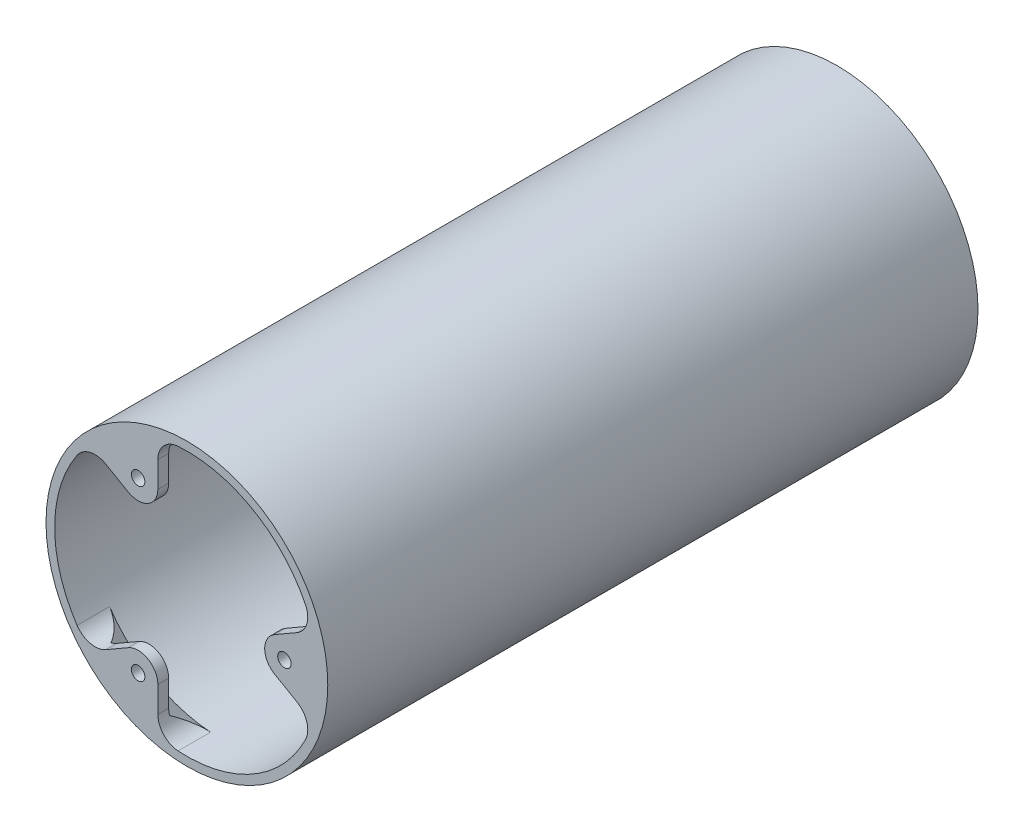
from build123d import *

# Parameters (mm, degrees)
SKETCH1_R           = 32.5
SKETCH1_R_2         = 30.5
BOSS_EXTRUDE1_DEPTH = 150
BOSS_EXTRUDE2_START = -2.5
SKETCH2_R           = 1.55
BOSS_EXTRUDE2_DEPTH = 2.5
FILLET1_R           = 5
CHAMFER1_START      = 142.49999956
CHAMFER1_DEPTH      = 5.00000044
CHAMFER1_START_2    = 142.499980406
CHAMFER1_3_DEPTH    = 5.000019594


with BuildPart() as part:
    # Sketch1 → Boss-Extrude1 (new body)
    with BuildSketch(Plane.XY):
        Circle(SKETCH1_R)
        Circle(SKETCH1_R_2, mode=Mode.SUBTRACT)
    extrude(amount=BOSS_EXTRUDE1_DEPTH)

    # Sketch2 → Boss-Extrude2 (add)
    # profile 1 of 3: a face of its own
    with BuildSketch(Plane.XY.offset(150).offset(BOSS_EXTRUDE2_START)):
        with BuildLine():
            Line((20.225, -3.940415587), (29.118585526, -9.075129585))
            ThreePointArc((29.118585526, -9.075129585), (30.152668692, -4.58983341), (30.5, 0))
            ThreePointArc((30.5, 0), (30.152668692, 4.58983341), (29.118585526, 9.075129585))
            Line((29.118585526, 9.075129585), (20.225, 3.940415587))
            ThreePointArc((20.225, 3.940415587), (17.95, 0), (20.225, -3.940415587))
        make_face()
        with Locations((22.5, 0)):
            Circle(SKETCH2_R, mode=Mode.SUBTRACT)
    # profile 2 of 3: a face of its own
    with BuildSketch(Plane.XY.offset(150).offset(BOSS_EXTRUDE2_START)):
        with BuildLine():
            ThreePointArc((-6.7, 29.75499958), (-15.25, 26.413774815), (-22.418585526, 20.679869995))
            Line((-22.418585526, 20.679869995), (-13.525, 15.545155998))
            ThreePointArc((-13.525, 15.545155998), (-8.975, 15.545155998), (-6.7, 19.485571585))
            Line((-6.7, 19.485571585), (-6.7, 29.75499958))
        make_face()
        with Locations((-11.25, 19.485571585)):
            Circle(SKETCH2_R, mode=Mode.SUBTRACT)
    # profile 3 of 3: a face of its own
    with BuildSketch(Plane.XY.offset(150).offset(BOSS_EXTRUDE2_START)):
        with BuildLine():
            ThreePointArc((-22.418585526, -20.679869995), (-15.25, -26.413774815), (-6.7, -29.75499958))
            Line((-6.7, -29.75499958), (-6.7, -19.485571585))
            ThreePointArc((-6.7, -19.485571585), (-8.975, -15.545155998), (-13.525, -15.545155998))
            Line((-13.525, -15.545155998), (-22.418585526, -20.679869995))
        make_face()
        with Locations((-11.25, -19.485571585)):
            Circle(SKETCH2_R, mode=Mode.SUBTRACT)
    extrude(amount=BOSS_EXTRUDE2_DEPTH)

    # Fillet1
    fillet1_edges = [part.edges().sort_by_distance(p)[0] for p in [
        (29.118585526, 9.075129585, 148.75),
        (29.118585526, -9.075129585, 148.75),
        (-22.418585526, 20.679869995, 148.75),
        (-6.7, 29.75499958, 148.75),
        (-6.7, -29.75499958, 148.75),
        (-22.418585526, -20.679869995, 148.75),
    ]]
    fillet(fillet1_edges, radius=FILLET1_R)

    # Chamfer1: read off the stored shape, not the designer's step
    # Chamfer1 outline → Chamfer1 (add)
    with BuildSketch(Plane.XY.offset(CHAMFER1_START)):
        with BuildLine():
            ThreePointArc((27.37167884, -13.455155052), (30.5, 0), (27.37167884, 13.455155052))
            ThreePointArc((27.37167884, 13.455155052), (15.25, 26.413774815), (-2.033333333, 30.432146746))
            ThreePointArc((-2.033333333, 30.432146746), (-15.25, 26.413774816), (-25.338345507, 16.976991694))
            ThreePointArc((-25.338345507, 16.976991694), (-30.5, 0), (-25.338345507, -16.976991694))
            ThreePointArc((-25.338345507, -16.976991694), (-15.25, -26.413774816), (-2.033333333, -30.432146746))
            ThreePointArc((-2.033333333, -30.432146746), (15.25, -26.413774815), (27.37167884, -13.455155052))
        make_face()
    extrude(amount=CHAMFER1_DEPTH)

    # Chamfer1 2 outline → Chamfer1 2 (revolve, cut)
    with BuildSketch(Plane.XZ):
        Polygon((0, 142.499980406), (30.500011313, 142.499980406), (27.613248654, 147.5), (0, 147.5), align=None)
    revolve(axis=Axis((0, 0, 0), (0, 0, 1)), mode=Mode.SUBTRACT)

    # Chamfer1 3 outline → Chamfer1 3 (cut)
    with BuildSketch(Plane.XY.offset(CHAMFER1_START_2)):
        with BuildLine():
            ThreePointArc((-2.033333333, 30.432146746), (-4.834338384, 29.33889892), (-6.501863856, 26.836863968))
            ThreePointArc((-6.501863856, 26.836863968), (13.806624327, 23.913774815), (26.492337882, 7.787652712))
            ThreePointArc((26.492337882, 7.787652712), (27.825400976, 10.482789609), (27.37167884, 13.455155052))
            ThreePointArc((27.37167884, 13.455155052), (15.25, 26.413774815), (-2.033333333, 30.432146746))
        make_face()
        with BuildLine():
            ThreePointArc((26.492337882, -7.787652712), (13.806624327, -23.913774815), (-6.501863856, -26.836863968))
            ThreePointArc((-6.501863856, -26.836863968), (-4.834338384, -29.33889892), (-2.033333333, -30.432146746))
            ThreePointArc((-2.033333333, -30.432146746), (15.25, -26.413774815), (27.37167884, -13.455155052))
            ThreePointArc((27.37167884, -13.455155052), (27.825400976, -10.482789609), (26.492337882, -7.787652712))
        make_face()
        with BuildLine():
            ThreePointArc((-25.338345507, 16.976991694), (-30.5, 0), (-25.338345507, -16.976991694))
            ThreePointArc((-25.338345507, -16.976991694), (-22.991062592, -18.856109312), (-19.990474026, -19.049211255))
            ThreePointArc((-19.990474026, -19.049211255), (-27.613248654, 0), (-19.990474026, 19.049211255))
            ThreePointArc((-19.990474026, 19.049211255), (-22.991062592, 18.856109311), (-25.338345507, 16.976991694))
        make_face()
    extrude(amount=CHAMFER1_3_DEPTH, mode=Mode.SUBTRACT)


solid = part.part
